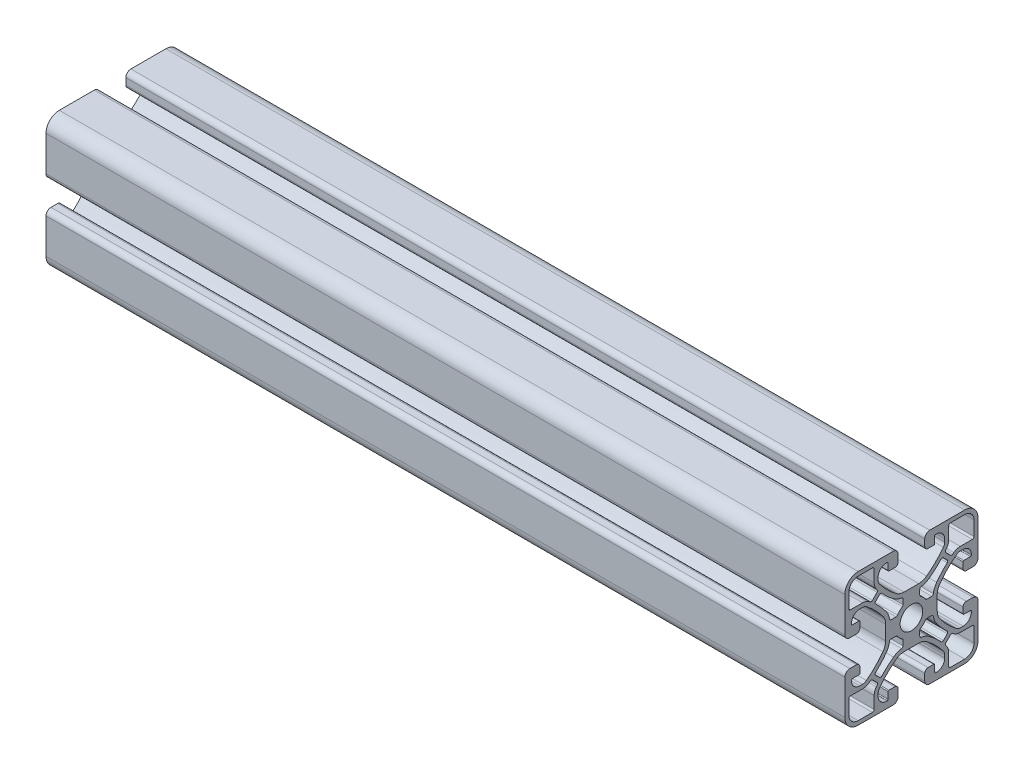
from build123d import *

# Parameters (mm, degrees)
SKETCH1_R           = 2.159
BOSS_EXTRUDE1_DEPTH = 152.4


with BuildPart() as part:
    # Sketch1 → Boss-Extrude1 (new body)
    with BuildSketch(Plane.YZ):
        with BuildLine():
            Line((0.772520695, -13.711151156), (0.772520695, -14.981151156))
            ThreePointArc((0.772520695, -14.981151156), (0.493539904, -15.654670365), (-0.179979305, -15.933651156))
            Line((-0.179979305, -15.933651156), (-6.847479304, -15.933651156))
            ThreePointArc((-6.847479304, -15.933651156), (-8.643530528, -15.18970238), (-9.387479304, -13.393651156))
            Line((-9.387479304, -13.393651156), (-9.387479304, -6.726151156))
            ThreePointArc((-9.387479304, -6.726151156), (-9.108498513, -6.052631947), (-8.434979304, -5.773651156))
            Line((-8.434979304, -5.773651156), (-7.164979304, -5.773651156))
            ThreePointArc((-7.164979304, -5.773651156), (-6.715966498, -5.95963835), (-6.529979304, -6.408651156))
            Line((-6.529979304, -6.408651156), (-6.529979304, -7.519901156))
            ThreePointArc((-6.529979304, -7.519901156), (-6.576476103, -7.632154358), (-6.688729304, -7.678651156))
            Line((-6.688729304, -7.678651156), (-7.958729304, -7.678651156))
            ThreePointArc((-7.958729304, -7.678651156), (-8.070982506, -7.725147955), (-8.117479304, -7.837401156))
            Line((-8.117479304, -7.837401156), (-8.117479304, -7.996151156))
            ThreePointArc((-8.117479304, -7.996151156), (-7.652511319, -9.118683171), (-6.529979304, -9.583651156))
            Line((-6.529979304, -9.583651156), (-6.034908058, -9.583651156))
            ThreePointArc((-6.034908058, -9.583651156), (-5.630688087, -9.517605564), (-5.268510552, -9.326338111))
            ThreePointArc((-5.268510552, -9.326338111), (-3.576591903, -7.846310071), (-2.110681684, -6.142144896))
            ThreePointArc((-2.110681684, -6.142144896), (-1.737480566, -5.424665046), (-1.608729304, -4.626241899))
            Line((-1.608729304, -4.626241899), (-1.608729304, -1.84106041))
            ThreePointArc((-1.608729304, -1.84106041), (-1.737480566, -1.042637264), (-2.110681683, -0.325157416))
            ThreePointArc((-2.110681683, -0.325157416), (-3.576591906, 1.379007761), (-5.268510559, 2.859035802))
            ThreePointArc((-5.268510559, 2.859035802), (-5.630688091, 3.050303253), (-6.034908058, 3.116348845))
            Line((-6.034908058, 3.116348845), (-6.529979305, 3.116348845))
            ThreePointArc((-6.529979305, 3.116348845), (-7.65251132, 2.65138086), (-8.117479305, 1.528848845))
            Line((-8.117479305, 1.528848845), (-8.117479305, 1.370098845))
            ThreePointArc((-8.117479305, 1.370098845), (-8.070982507, 1.257845643), (-7.958729305, 1.211348845))
            Line((-7.958729305, 1.211348845), (-6.688729305, 1.211348845))
            ThreePointArc((-6.688729305, 1.211348845), (-6.576476104, 1.164852046), (-6.529979305, 1.052598845))
            Line((-6.529979305, 1.052598845), (-6.529979305, -0.058651155))
            ThreePointArc((-6.529979305, -0.058651155), (-6.715966499, -0.507663961), (-7.164979305, -0.693651155))
            Line((-7.164979305, -0.693651155), (-8.434979305, -0.693651155))
            ThreePointArc((-8.434979305, -0.693651155), (-9.108498514, -0.414670364), (-9.387479305, 0.258848845))
            Line((-9.387479305, 0.258848845), (-9.387479305, 6.926348844))
            ThreePointArc((-9.387479305, 6.926348844), (-8.643530529, 8.722400069), (-6.847479305, 9.466348844))
            Line((-6.847479305, 9.466348844), (-0.179979306, 9.466348844))
            ThreePointArc((-0.179979306, 9.466348844), (0.493539903, 9.187368053), (0.772520694, 8.513848844))
            Line((0.772520694, 8.513848844), (0.772520694, 7.243848844))
            ThreePointArc((0.772520694, 7.243848844), (0.5865335, 6.794836038), (0.137520694, 6.608848844))
            Line((0.137520694, 6.608848844), (-0.973729306, 6.608848844))
            ThreePointArc((-0.973729306, 6.608848844), (-1.085982507, 6.655345643), (-1.132479306, 6.767598844))
            Line((-1.132479306, 6.767598844), (-1.132479306, 8.037598844))
            ThreePointArc((-1.132479306, 8.037598844), (-1.178976104, 8.149852046), (-1.291229306, 8.196348844))
            Line((-1.291229306, 8.196348844), (-1.449979306, 8.196348844))
            ThreePointArc((-1.449979306, 8.196348844), (-2.572511321, 7.73138086), (-3.037479306, 6.608848844))
            Line((-3.037479306, 6.608848844), (-3.037479306, 6.113777598))
            ThreePointArc((-3.037479306, 6.113777598), (-2.971433714, 5.709557627), (-2.780166261, 5.347380093))
            ThreePointArc((-2.780166261, 5.347380093), (-1.30013822, 3.655461444), (0.404026955, 2.189551224))
            ThreePointArc((0.404026955, 2.189551224), (1.121506805, 1.816350106), (1.919929952, 1.687598845))
            Line((1.919929952, 1.687598845), (4.705111441, 1.687598845))
            ThreePointArc((4.705111441, 1.687598845), (5.503534586, 1.816350106), (6.221014435, 2.189551223))
            ThreePointArc((6.221014435, 2.189551223), (7.925179612, 3.655461446), (9.405207653, 5.3473801))
            ThreePointArc((9.405207653, 5.3473801), (9.596475104, 5.709557631), (9.662520695, 6.113777598))
            Line((9.662520695, 6.113777598), (9.662520695, 6.608848846))
            ThreePointArc((9.662520695, 6.608848846), (9.197552711, 7.731380861), (8.075020695, 8.196348846))
            Line((8.075020695, 8.196348846), (7.916270695, 8.196348846))
            ThreePointArc((7.916270695, 8.196348846), (7.804017494, 8.149852047), (7.757520695, 8.037598846))
            Line((7.757520695, 8.037598846), (7.757520695, 6.767598846))
            ThreePointArc((7.757520695, 6.767598846), (7.711023897, 6.655345644), (7.598770695, 6.608848846))
            Line((7.598770695, 6.608848846), (6.487520696, 6.608848846))
            ThreePointArc((6.487520696, 6.608848846), (6.03850789, 6.79483604), (5.852520696, 7.243848846))
            Line((5.852520696, 7.243848846), (5.852520696, 8.513848846))
            ThreePointArc((5.852520696, 8.513848846), (6.131501487, 9.187368055), (6.805020696, 9.466348846))
            Line((6.805020696, 9.466348846), (13.472520695, 9.466348846))
            ThreePointArc((13.472520695, 9.466348846), (15.268571919, 8.72240007), (16.012520695, 6.926348846))
            Line((16.012520695, 6.926348846), (16.012520695, 0.258848846))
            ThreePointArc((16.012520695, 0.258848846), (15.733539904, -0.414670363), (15.060020695, -0.693651154))
            Line((15.060020695, -0.693651154), (13.790020695, -0.693651154))
            ThreePointArc((13.790020695, -0.693651154), (13.341007889, -0.50766396), (13.155020695, -0.058651154))
            Line((13.155020695, -0.058651154), (13.155020695, 1.052598846))
            ThreePointArc((13.155020695, 1.052598846), (13.201517494, 1.164852048), (13.313770695, 1.211348846))
            Line((13.313770695, 1.211348846), (14.583770695, 1.211348846))
            ThreePointArc((14.583770695, 1.211348846), (14.696023897, 1.257845645), (14.742520695, 1.370098846))
            Line((14.742520695, 1.370098846), (14.742520695, 1.528848846))
            ThreePointArc((14.742520695, 1.528848846), (14.27755271, 2.651380861), (13.155020695, 3.116348846))
            Line((13.155020695, 3.116348846), (12.659949449, 3.116348846))
            ThreePointArc((12.659949449, 3.116348846), (12.255729478, 3.050303254), (11.893551943, 2.859035801))
            ThreePointArc((11.893551943, 2.859035801), (10.201633294, 1.37900776), (8.735723075, -0.325157415))
            ThreePointArc((8.735723075, -0.325157415), (8.362521957, -1.042637264), (8.233770695, -1.841060411))
            Line((8.233770695, -1.841060411), (8.233770695, -4.626241901))
            ThreePointArc((8.233770695, -4.626241901), (8.362521957, -5.424665046), (8.735723074, -6.142144894))
            ThreePointArc((8.735723074, -6.142144894), (10.201633297, -7.846310072), (11.89355195, -9.326338113))
            ThreePointArc((11.89355195, -9.326338113), (12.255729482, -9.517605564), (12.659949449, -9.583651155))
            Line((12.659949449, -9.583651155), (13.155020696, -9.583651155))
            ThreePointArc((13.155020696, -9.583651155), (14.277552711, -9.11868317), (14.742520696, -7.996151155))
            Line((14.742520696, -7.996151155), (14.742520696, -7.837401155))
            ThreePointArc((14.742520696, -7.837401155), (14.696023898, -7.725147954), (14.583770696, -7.678651155))
            Line((14.583770696, -7.678651155), (13.313770696, -7.678651155))
            ThreePointArc((13.313770696, -7.678651155), (13.201517495, -7.632154357), (13.155020696, -7.519901155))
            Line((13.155020696, -7.519901155), (13.155020696, -6.408651155))
            ThreePointArc((13.155020696, -6.408651155), (13.34100789, -5.959638349), (13.790020696, -5.773651155))
            Line((13.790020696, -5.773651155), (15.060020696, -5.773651155))
            ThreePointArc((15.060020696, -5.773651155), (15.733539905, -6.052631946), (16.012520696, -6.726151155))
            Line((16.012520696, -6.726151155), (16.012520696, -13.393651155))
            ThreePointArc((16.012520696, -13.393651155), (15.26857192, -15.189702379), (13.472520696, -15.933651155))
            Line((13.472520696, -15.933651155), (6.805020697, -15.933651155))
            ThreePointArc((6.805020697, -15.933651155), (6.131501488, -15.654670364), (5.852520697, -14.981151155))
            Line((5.852520697, -14.981151155), (5.852520697, -13.711151155))
            ThreePointArc((5.852520697, -13.711151155), (6.038507891, -13.262138349), (6.487520697, -13.076151155))
            Line((6.487520697, -13.076151155), (7.598770697, -13.076151155))
            ThreePointArc((7.598770697, -13.076151155), (7.711023898, -13.122647953), (7.757520697, -13.234901155))
            Line((7.757520697, -13.234901155), (7.757520697, -14.504901155))
            ThreePointArc((7.757520697, -14.504901155), (7.804017495, -14.617154356), (7.916270697, -14.663651155))
            Line((7.916270697, -14.663651155), (8.075020697, -14.663651155))
            ThreePointArc((8.075020697, -14.663651155), (9.197552712, -14.19868317), (9.662520697, -13.076151155))
            Line((9.662520697, -13.076151155), (9.662520697, -12.581079908))
            ThreePointArc((9.662520697, -12.581079908), (9.596475104, -12.176859938), (9.405207651, -11.814682403))
            ThreePointArc((9.405207651, -11.814682403), (7.925179611, -10.122763754), (6.221014436, -8.656853534))
            ThreePointArc((6.221014436, -8.656853534), (5.503534586, -8.283652417), (4.705111439, -8.154901155))
            Line((4.705111439, -8.154901155), (1.91992995, -8.154901155))
            ThreePointArc((1.91992995, -8.154901155), (1.121506805, -8.283652417), (0.404026956, -8.656853534))
            ThreePointArc((0.404026956, -8.656853534), (-1.300138221, -10.122763756), (-2.780166262, -11.81468241))
            ThreePointArc((-2.780166262, -11.81468241), (-2.971433713, -12.176859941), (-3.037479304, -12.581079908))
            Line((-3.037479304, -12.581079908), (-3.037479304, -13.076151156))
            ThreePointArc((-3.037479304, -13.076151156), (-2.57251132, -14.198683171), (-1.449979305, -14.663651156))
            Line((-1.449979305, -14.663651156), (-1.291229305, -14.663651156))
            ThreePointArc((-1.291229305, -14.663651156), (-1.178976103, -14.617154357), (-1.132479305, -14.504901156))
            Line((-1.132479305, -14.504901156), (-1.132479305, -13.234901156))
            ThreePointArc((-1.132479305, -13.234901156), (-1.085982506, -13.122647954), (-0.973729305, -13.076151156))
            Line((-0.973729305, -13.076151156), (0.137520695, -13.076151156))
            ThreePointArc((0.137520695, -13.076151156), (0.586533501, -13.26213835), (0.772520695, -13.711151156))
        make_face()
        with Locations((3.312520697, -3.233651155)):
            Circle(SKETCH1_R, mode=Mode.SUBTRACT)
        with BuildLine():
            Line((9.84481504, 4.637844283), (10.012608151, 4.8557916))
            ThreePointArc((10.012608151, 4.8557916), (10.318636081, 5.435275655), (10.42430903, 6.082027611))
            Line((10.42430903, 6.082027611), (10.42430903, 8.386848856))
            ThreePointArc((10.42430903, 8.386848856), (10.517302627, 8.611355259), (10.74180903, 8.704348856))
            Line((10.74180903, 8.704348856), (13.472309014, 8.704348856))
            ThreePointArc((13.472309014, 8.704348856), (14.729544877, 8.183584711), (15.250309023, 6.926348847))
            Line((15.250309023, 6.926348847), (15.250309023, 4.19584885))
            ThreePointArc((15.250309023, 4.19584885), (15.157315426, 3.971342447), (14.932809023, 3.87834885))
            Line((14.932809023, 3.87834885), (12.627987776, 3.87834885))
            ThreePointArc((12.627987776, 3.87834885), (11.981235825, 3.772675903), (11.401751773, 3.466647978))
            Line((11.401751773, 3.466647978), (11.183804456, 3.298854867))
            ThreePointArc((11.183804456, 3.298854867), (10.968844184, 3.23190561), (10.763539377, 3.324318043))
            Line((10.763539377, 3.324318043), (9.870278216, 4.217579204))
            ThreePointArc((9.870278216, 4.217579204), (9.777865783, 4.422884011), (9.84481504, 4.637844283))
        make_face(mode=Mode.SUBTRACT)
        with BuildLine():
            Line((-4.558974742, 3.298643188), (-4.776922058, 3.466436299))
            ThreePointArc((-4.776922058, 3.466436299), (-5.35640611, 3.772464224), (-6.003158061, 3.878137171))
            Line((-6.003158061, 3.878137171), (-8.307979315, 3.878137171))
            ThreePointArc((-8.307979315, 3.878137171), (-8.532485718, 3.971130768), (-8.625479315, 4.195637171))
            Line((-8.625479315, 4.195637171), (-8.625479315, 6.926137161))
            ThreePointArc((-8.625479315, 6.926137161), (-8.104715169, 8.183373025), (-6.847479306, 8.704137171))
            Line((-6.847479306, 8.704137171), (-4.116979309, 8.704137171))
            ThreePointArc((-4.116979309, 8.704137171), (-3.892472906, 8.611143574), (-3.799479309, 8.386637171))
            Line((-3.799479309, 8.386637171), (-3.799479309, 6.081815924))
            ThreePointArc((-3.799479309, 6.081815924), (-3.693806362, 5.435063973), (-3.387778437, 4.85557992))
            Line((-3.387778437, 4.85557992), (-3.219985326, 4.637632604))
            ThreePointArc((-3.219985326, 4.637632604), (-3.153036069, 4.422672332), (-3.245448502, 4.217367525))
            Line((-3.245448502, 4.217367525), (-4.138709663, 3.324106364))
            ThreePointArc((-4.138709663, 3.324106364), (-4.34401447, 3.231693931), (-4.558974742, 3.298643188))
        make_face(mode=Mode.SUBTRACT)
        with BuildLine():
            Line((4.900020697, -0.306445792), (4.900020697, 0.638730742))
            ThreePointArc((4.900020697, 0.638730742), (4.978885643, 0.848157487), (5.176301398, 0.953543734))
            ThreePointArc((5.176301398, 0.953543734), (5.993365908, 1.169605569), (6.728820708, 1.585998853))
            ThreePointArc((6.728820708, 1.585998853), (7.886169011, 2.538405301), (8.953104421, 3.591107524))
            ThreePointArc((8.953104421, 3.591107524), (9.179965542, 3.692814602), (9.41055899, 3.599879359))
            Line((9.41055899, 3.599879359), (10.146051215, 2.864387135))
            ThreePointArc((10.146051215, 2.864387135), (10.238986457, 2.633793689), (10.137279379, 2.406932571))
            ThreePointArc((10.137279379, 2.406932571), (9.084577143, 1.339997151), (8.132170687, 0.182648832))
            ThreePointArc((8.132170687, 0.182648832), (7.715777415, -0.552805957), (7.499715586, -1.369870454))
            ThreePointArc((7.499715586, -1.369870454), (7.39432934, -1.567286209), (7.184902595, -1.646151156))
            Line((7.184902595, -1.646151156), (6.23972607, -1.646151156))
            ThreePointArc((6.23972607, -1.646151156), (6.08836388, -1.607749235), (5.973616485, -1.501832971))
            ThreePointArc((5.973616485, -1.501832971), (5.557584726, -0.98858712), (5.044338875, -0.572555363))
            ThreePointArc((5.044338875, -0.572555363), (4.938422615, -0.457807974), (4.900020697, -0.306445792))
        make_face(mode=Mode.SUBTRACT)
        with BuildLine():
            Line((0.385315334, -1.646151156), (-0.559861201, -1.646151156))
            ThreePointArc((-0.559861201, -1.646151156), (-0.769287945, -1.567286209), (-0.874674192, -1.369870455))
            ThreePointArc((-0.874674192, -1.369870455), (-1.090736028, -0.552805945), (-1.507129311, 0.182648856))
            ThreePointArc((-1.507129311, 0.182648856), (-2.459535759, 1.339997159), (-3.512237982, 2.406932568))
            ThreePointArc((-3.512237982, 2.406932568), (-3.61394506, 2.633793689), (-3.521009818, 2.864387138))
            Line((-3.521009818, 2.864387138), (-2.785517593, 3.599879363))
            ThreePointArc((-2.785517593, 3.599879363), (-2.554924147, 3.692814604), (-2.328063029, 3.591107527))
            ThreePointArc((-2.328063029, 3.591107527), (-1.26112761, 2.538405291), (-0.103779291, 1.585998835))
            ThreePointArc((-0.103779291, 1.585998835), (0.631675499, 1.169605562), (1.448739995, 0.953543734))
            ThreePointArc((1.448739995, 0.953543734), (1.64615575, 0.848157487), (1.725020697, 0.638730743))
            Line((1.725020697, 0.638730743), (1.725020697, -0.306445783))
            ThreePointArc((1.725020697, -0.306445783), (1.686618777, -0.457807972), (1.580702512, -0.572555367))
            ThreePointArc((1.580702512, -0.572555367), (1.067456662, -0.988587126), (0.651424905, -1.501832978))
            ThreePointArc((0.651424905, -1.501832978), (0.536677515, -1.607749237), (0.385315334, -1.646151156))
        make_face(mode=Mode.SUBTRACT)
        with BuildLine():
            Line((-3.219773646, -11.105146594), (-3.387566758, -11.32309391))
            ThreePointArc((-3.387566758, -11.32309391), (-3.693594682, -11.902577963), (-3.79926763, -12.549329913))
            Line((-3.79926763, -12.549329913), (-3.79926763, -14.854151161))
            ThreePointArc((-3.79926763, -14.854151161), (-3.892261226, -15.078657564), (-4.116767629, -15.171651161))
            Line((-4.116767629, -15.171651161), (-6.847267613, -15.171651161))
            ThreePointArc((-6.847267613, -15.171651161), (-8.104503477, -14.650887015), (-8.625267623, -13.393651152))
            Line((-8.625267623, -13.393651152), (-8.625267623, -10.663151161))
            ThreePointArc((-8.625267623, -10.663151161), (-8.532274026, -10.438644758), (-8.307767623, -10.345651161))
            Line((-8.307767623, -10.345651161), (-6.002946382, -10.345651161))
            ThreePointArc((-6.002946382, -10.345651161), (-5.356194431, -10.239978214), (-4.776710379, -9.933950289))
            Line((-4.776710379, -9.933950289), (-4.558763062, -9.766157178))
            ThreePointArc((-4.558763062, -9.766157178), (-4.34380279, -9.699207921), (-4.138497984, -9.791620354))
            Line((-4.138497984, -9.791620354), (-3.245236822, -10.684881515))
            ThreePointArc((-3.245236822, -10.684881515), (-3.152824389, -10.890186322), (-3.219773646, -11.105146594))
        make_face(mode=Mode.SUBTRACT)
        with BuildLine():
            Line((11.184016136, -9.765945499), (11.401963452, -9.93373861))
            ThreePointArc((11.401963452, -9.93373861), (11.981447504, -10.239766535), (12.628199455, -10.345439482))
            Line((12.628199455, -10.345439482), (14.933020703, -10.345439482))
            ThreePointArc((14.933020703, -10.345439482), (15.157527106, -10.438433079), (15.250520703, -10.662939482))
            Line((15.250520703, -10.662939482), (15.250520703, -13.393439466))
            ThreePointArc((15.250520703, -13.393439466), (14.729756557, -14.650675329), (13.472520693, -15.171439475))
            Line((13.472520693, -15.171439475), (10.742020697, -15.171439475))
            ThreePointArc((10.742020697, -15.171439475), (10.517514293, -15.078445878), (10.424520697, -14.853939475))
            Line((10.424520697, -14.853939475), (10.424520697, -12.549118226))
            ThreePointArc((10.424520697, -12.549118226), (10.318847751, -11.90236628), (10.012819831, -11.322882231))
            Line((10.012819831, -11.322882231), (9.84502672, -11.104934915))
            ThreePointArc((9.84502672, -11.104934915), (9.778077463, -10.889974643), (9.870489896, -10.684669836))
            Line((9.870489896, -10.684669836), (10.763751057, -9.791408675))
            ThreePointArc((10.763751057, -9.791408675), (10.969055864, -9.698996242), (11.184016136, -9.765945499))
        make_face(mode=Mode.SUBTRACT)
        with BuildLine():
            Line((1.725020697, -6.160856519), (1.725020697, -7.106033053))
            ThreePointArc((1.725020697, -7.106033053), (1.646155751, -7.315459798), (1.448739996, -7.420846044))
            ThreePointArc((1.448739996, -7.420846044), (0.631675486, -7.63690788), (-0.103779314, -8.053301163))
            ThreePointArc((-0.103779314, -8.053301163), (-1.261127617, -9.005707612), (-2.328063027, -10.058409834))
            ThreePointArc((-2.328063027, -10.058409834), (-2.554924148, -10.160116913), (-2.785517596, -10.06718167))
            Line((-2.785517596, -10.06718167), (-3.521009821, -9.331689445))
            ThreePointArc((-3.521009821, -9.331689445), (-3.613945063, -9.101096), (-3.512237985, -8.874234882))
            ThreePointArc((-3.512237985, -8.874234882), (-2.459535749, -7.807299462), (-1.507129293, -6.649951143))
            ThreePointArc((-1.507129293, -6.649951143), (-1.090736021, -5.914496353), (-0.874674192, -5.097431857))
            ThreePointArc((-0.874674192, -5.097431857), (-0.769287946, -4.900016102), (-0.559861201, -4.821151155))
            Line((-0.559861201, -4.821151155), (0.385315324, -4.821151155))
            ThreePointArc((0.385315324, -4.821151155), (0.536677514, -4.859553075), (0.651424909, -4.96546934))
            ThreePointArc((0.651424909, -4.96546934), (1.067456668, -5.478715191), (1.580702519, -5.894746948))
            ThreePointArc((1.580702519, -5.894746948), (1.686618779, -6.009494337), (1.725020697, -6.160856519))
        make_face(mode=Mode.SUBTRACT)
        with BuildLine():
            Line((6.23972606, -4.821151155), (7.184902595, -4.821151155))
            ThreePointArc((7.184902595, -4.821151155), (7.394329339, -4.900016102), (7.499715586, -5.097431856))
            ThreePointArc((7.499715586, -5.097431856), (7.715777422, -5.914496366), (8.132170705, -6.649951166))
            ThreePointArc((8.132170705, -6.649951166), (9.084577153, -7.80729947), (10.137279376, -8.874234879))
            ThreePointArc((10.137279376, -8.874234879), (10.238986455, -9.101096), (10.146051212, -9.331689449))
            Line((10.146051212, -9.331689449), (9.410558987, -10.067181674))
            ThreePointArc((9.410558987, -10.067181674), (9.179965541, -10.160116915), (8.953104423, -10.058409837))
            ThreePointArc((8.953104423, -10.058409837), (7.886169003, -9.005707601), (6.728820685, -8.053301146))
            ThreePointArc((6.728820685, -8.053301146), (5.993365895, -7.636907873), (5.176301399, -7.420846045))
            ThreePointArc((5.176301399, -7.420846045), (4.978885644, -7.315459798), (4.900020697, -7.106033054))
            Line((4.900020697, -7.106033054), (4.900020697, -6.160856528))
            ThreePointArc((4.900020697, -6.160856528), (4.938422617, -6.009494339), (5.044338882, -5.894746943))
            ThreePointArc((5.044338882, -5.894746943), (5.557584732, -5.478715185), (5.973616489, -4.965469333))
            ThreePointArc((5.973616489, -4.965469333), (6.088363879, -4.859553074), (6.23972606, -4.821151155))
        make_face(mode=Mode.SUBTRACT)
    extrude(amount=BOSS_EXTRUDE1_DEPTH)


solid = part.part
